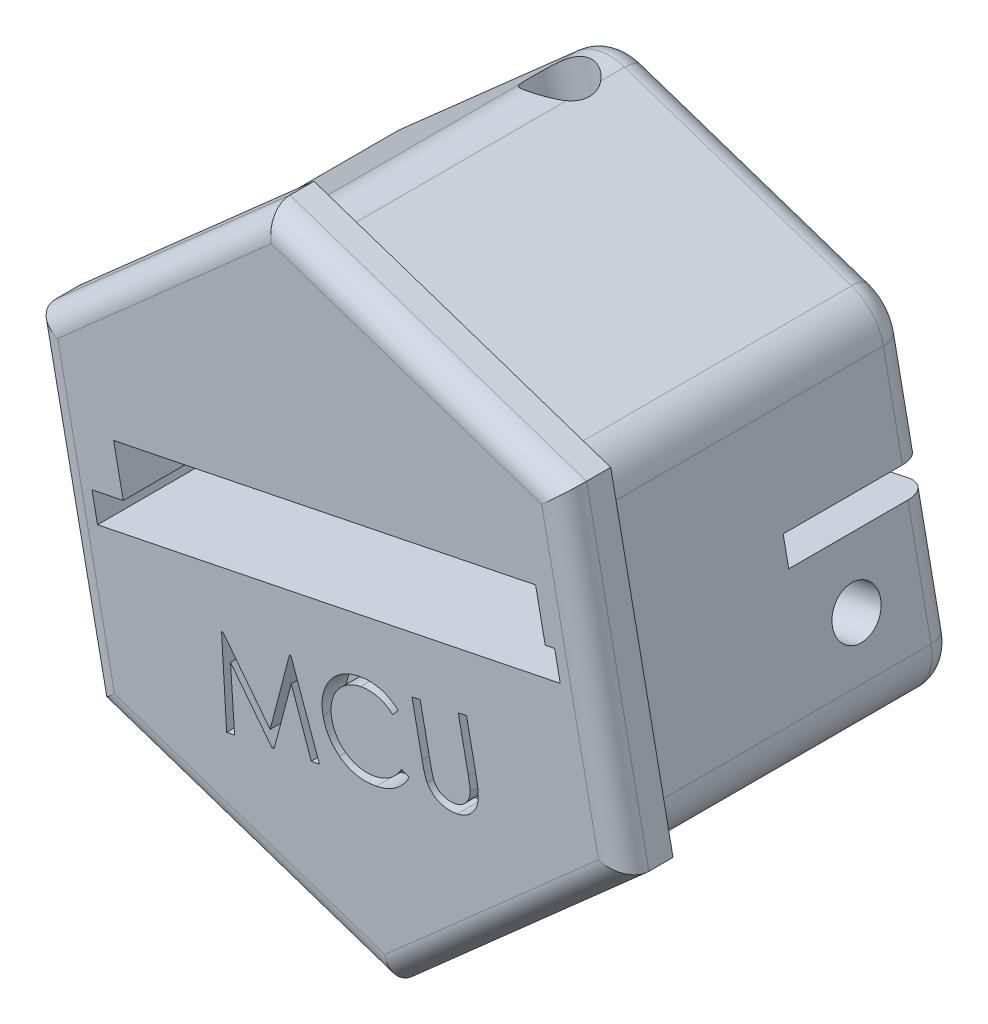
from build123d import *

# Parameters (mm, degrees)
DODANIE_WYCI_GNI_CIE1_DEPTH     = 14.65
ZAOKR_GLENIE1_R                 = 2
DODANIE_WYCI_GNI_CIE2_DEPTH     = 2
ZAOKR_GLENIE2_R                 = 1
ZAOKR_GLENIE3_R                 = 1
WYTNIJ_WYCI_GNI_CIE1_DEPTH      = 31.146962562
WYTNIJ_WYCI_GNI_CIE1_DEPTH_BACK = 31.146962562
SZKIC4_R                        = 1.225
GNIAZDO1_DEPTH                  = 14.65
GNIAZDO1_START                  = 1.35
GNIAZDO1_2_DEPTH                = 4.6
WYTNIJ_WYCI_GNI_CIE2_DEPTH      = 30.742315121
WYTNIJ_WYCI_GNI_CIE8_DEPTH      = 30.742315121
WYTNIJ_WYCI_GNI_CIE9_DEPTH      = 28.30701025
WYTNIJ_WYCI_GNI_CIE10_DEPTH     = 0.163959166
SZKIC10_R                       = 1.000244947
WYTNIJ_WYCI_GNI_CIE11_DEPTH     = 31.433256246
WYTNIJ_WYCI_GNI_CIE12_DEPTH     = 1


# Read off the part's stored shape, not the designer's step: Gniazdo1
with BuildPart() as part:
    # Szkic1 → Dodanie-wyciągnięcie1 (new body)
    with BuildSketch(Plane.XY):
        Polygon((1.783068787, -4.564092652), (-0.653727134, 7.430712848), (-12.25993137, 11.317788426), (-21.429339686, 3.210058505), (-18.992543765, -8.784746995), (-7.386339528, -12.671822573), align=None)
    extrude(amount=DODANIE_WYCI_GNI_CIE1_DEPTH)

    # Zaokrąglenie1
    zaokr_glenie1_edges = [part.edges().sort_by_distance(p)[0] for p in [
        (-7.386339528, -12.671822573, 7.325),
        (-18.992543765, -8.784746995, 7.325),
        (-21.429339686, 3.210058505, 7.325),
        (-12.25993137, 11.317788426, 7.325),
        (-0.653727134, 7.430712848, 7.325),
        (1.783068787, -4.564092652, 7.325),
    ]]
    fillet(zaokr_glenie1_edges, radius=ZAOKR_GLENIE1_R)

    # Szkic3 → Dodanie-wyciągnięcie2 (add)
    with BuildSketch(Plane.XY.offset(14.65)):
        Polygon((-0.091452095, 7.927884965), (-12.409357535, 12.053318952), (-22.141040889, 3.448416913), (-19.554818803, -9.281919113), (-7.236913363, -13.407353099), (2.494769991, -4.80245106), align=None)
    extrude(amount=-DODANIE_WYCI_GNI_CIE2_DEPTH)

    # Zaokrąglenie2
    zaokr_glenie2_edges = [part.edges().sort_by_distance(p)[0] for p in [
        (-6.456829252, 9.374250637, 0),
        (-2.80163537, -8.617957613, 0),
        (-13.189441647, -10.728284784, 0),
        (-20.210941725, -2.787344245, 0),
        (-16.844635528, 7.263923465, 0),
        (0.564670827, 1.433310098, 0),
        (-12.198333493, 11.014581025, 0),
        (-21.135955436, 3.111800131, 0),
        (-18.760757392, -8.579797968, 0),
        (-7.447937406, -12.368615173, 0),
        (1.489684537, -4.465834278, 0),
        (-0.885513507, 7.225763821, 0),
    ]]
    fillet(zaokr_glenie2_edges, radius=ZAOKR_GLENIE2_R)

    # Zaokrąglenie3
    zaokr_glenie3_edges = [part.edges().sort_by_distance(p)[0] for p in [
        (1.201658948, 1.562716953, 14.65),
        (-6.250404815, 9.990601959, 14.65),
        (-17.275199212, 7.750867932, 14.65),
        (-20.847929846, -2.9167511, 14.65),
        (-13.395866083, -11.344636106, 14.65),
        (-2.371071686, -9.10490208, 14.65),
    ]]
    fillet(zaokr_glenie3_edges, radius=ZAOKR_GLENIE3_R)

    # Szkic4 → Wytnij-wyciągnięcie1 (cut, two sides: drawn at the far end of the back side and taken through both)
    with BuildSketch(Plane(origin=(-0.257260592, 1.266331223, 0), x_dir=(0.9799817241599056, 0.19908746899937949, 0), z_dir=(-0.19908746899937946, 0.9799817241599055, 0)).offset(-WYTNIJ_WYCI_GNI_CIE1_DEPTH_BACK)):
        with Locations(Location((-9.76127883, -2.7, 0), (0, 0, 215.281261827))):
            Circle(SZKIC4_R)
    extrude(amount=WYTNIJ_WYCI_GNI_CIE1_DEPTH + WYTNIJ_WYCI_GNI_CIE1_DEPTH_BACK, mode=Mode.SUBTRACT)

    # Gniazdo1 outline → Gniazdo1 (cut)
    with BuildSketch(Plane.XY):
        Polygon((-0.219314552, 1.274040123), (-0.418402021, 2.254021847), (-19.626043815, -1.648092546), (-19.426956346, -2.62807427), align=None)
    extrude(amount=GNIAZDO1_DEPTH, mode=Mode.SUBTRACT)

    # Gniazdo1 2 outline → Gniazdo1 2 (cut)
    with BuildSketch(Plane.XY.offset(GNIAZDO1_START)):
        Polygon((0.564670827, 1.433310098), (0.365583358, 2.413291822), (-0.418402021, 2.254021847), (-0.219314552, 1.274040123), align=None)
        Polygon((-19.426956346, -2.62807427), (-19.626043815, -1.648092546), (-20.410029194, -1.807362521), (-20.210941725, -2.787344245), align=None)
    extrude(amount=GNIAZDO1_2_DEPTH, mode=Mode.SUBTRACT)

    # Szkic6 → Wytnij-wyciągnięcie2 (cut, through all)
    with BuildSketch(Plane.XY.offset(14.65)):
        Polygon((-0.219314552, 1.274040123), (-0.192027252, 1.112275263), (-19.394314131, -2.788751256), (-19.426956346, -2.62807427), align=None)
    extrude(amount=-WYTNIJ_WYCI_GNI_CIE2_DEPTH, mode=Mode.SUBTRACT)

    # Szkic7 → Wytnij-wyciągnięcie8 (cut, through all)
    with BuildSketch(Plane.XY.offset(14.65)):
        Polygon((-18.725742969, 0.575661799), (-1.209956317, 4.141509915), (-0.7540154, 1.897201078), (-18.269802052, -1.668647037), align=None)
    extrude(amount=-WYTNIJ_WYCI_GNI_CIE8_DEPTH, mode=Mode.SUBTRACT)

    # Szkic8 → Wytnij-wyciągnięcie9 (cut, through all)
    with BuildSketch(Plane(origin=(0, 0, 5.95), x_dir=(-1, 0, 0), z_dir=(0, 0, -1))):
        Polygon((20.410029194, -1.807362521), (22.58129373, -1.97298962), (22.243381446, -3.656769832), (20.210941725, -2.787344245), (19.426956346, -2.62807427), (0.219314552, 1.274040123), (-0.564670827, 1.433310098), (-0.365583358, 2.413291822), (0.418402021, 2.254021847), align=None)
    extrude(amount=WYTNIJ_WYCI_GNI_CIE9_DEPTH, mode=Mode.SUBTRACT)

    # Szkic9 → Wytnij-wyciągnięcie10 (cut)
    with BuildSketch(Plane(origin=(-0.257260592, 1.266331223, 0), x_dir=(0.9799817241599056, 0.19908746899937946, 0), z_dir=(-0.19908746899937943, 0.9799817241599055, 0))):
        Polygon((-20.36127883, -5.95), (0.83872117, -5.95), (6.124332065, 1.817495391), (-11.25710048, 4.560709404), (-28.076377149, 1.817495391), align=None)
    extrude(amount=-WYTNIJ_WYCI_GNI_CIE10_DEPTH, mode=Mode.SUBTRACT)

    # Szkic10 → Wytnij-wyciągnięcie11 (cut, through all)
    with BuildSketch(Plane(origin=(0.821931418, 0.166978875, 0), x_dir=(0, 0, -1), z_dir=(0.9799817241599057, 0.19908746899937887, 0))):
        with Locations(Location((-3.64, -1.402615616, 0), (0, 0, 90))):
            Circle(SZKIC10_R)
    extrude(amount=-WYTNIJ_WYCI_GNI_CIE11_DEPTH, mode=Mode.SUBTRACT)

    # Szkic11 → Wytnij-wyciągnięcie12 (cut)
    with BuildSketch(Plane.XY.offset(14.65)):
        Polygon((-14.035451173, -7.571751691), (-14.245787712, -4.056327011), (-14.189697968, -4.044407941), (-12.230062552, -6.564940793), (-11.425875853, -3.482108261), (-11.370487231, -3.470890312), (-10.184890276, -6.787897524), (-10.521428738, -6.85660746), (-11.352959186, -4.481206819), (-12.063896686, -7.170008902), (-12.149433545, -7.187536947), (-13.874193161, -4.974796562), (-13.70592393, -7.504443998), align=None)
        with BuildLine():
            Line((-6.910536367, -3.225905594), (-7.13840095, -3.486722902))
            add(Edge.make_bspline(
                [(-7.13840095, -3.486722902), (-7.162000049, -3.466791083), (-7.208604172, -3.427429202), (-7.282370026, -3.373901885), (-7.357751438, -3.325027822), (-7.434814258, -3.280675207), (-7.513948305, -3.241713857), (-7.595265283, -3.208583595), (-7.678006999, -3.178490713), (-7.791255569, -3.147223263), (-7.936331683, -3.119164226), (-8.114894071, -3.107014335), (-8.297557987, -3.113997799), (-8.418820489, -3.135213195), (-8.480348065, -3.14597771)],
                knots=[0, 0, 0, 0, 0.773865221, 1.528249413, 2.281996801, 3.02439624, 3.755154224, 4.490381002, 5.223926405, 5.960015728, 7.43254381, 8.918000902, 10.436219505, 12, 12, 12, 12], degree=3))
            add(Edge.make_bspline(
                [(-8.480348065, -3.14597771), (-8.514092395, -3.153558439), (-8.580888013, -3.168564204), (-8.678719455, -3.197289141), (-8.773143474, -3.23244922), (-8.864078492, -3.274251042), (-8.95291266, -3.320063637), (-9.037766601, -3.373219626), (-9.119928495, -3.431231947), (-9.198276104, -3.495068878), (-9.272141371, -3.563129066), (-9.340191046, -3.635274533), (-9.404060928, -3.70931203), (-9.460450375, -3.788167294), (-9.51178169, -3.869603851), (-9.557831497, -3.953883391), (-9.596791508, -4.042117962), (-9.631259617, -4.132772786), (-9.65939673, -4.225962438), (-9.680317872, -4.320939439), (-9.69498923, -4.416967118), (-9.70371181, -4.514384146), (-9.704792485, -4.613254742), (-9.699871601, -4.713456563), (-9.688754143, -4.815112066), (-9.676411666, -4.882721099), (-9.670151751, -4.917011364)],
                knots=[0, 0, 0, 0, 1.045856326, 2.070232893, 3.081206146, 4.090324377, 5.095747147, 6.102014371, 7.115997874, 8.136048703, 9.156466831, 10.151424097, 11.134331547, 12.111350141, 13.080151876, 14.044818935, 15.013001594, 15.995019063, 16.97673121, 17.954261064, 18.933960799, 19.913099379, 20.909862832, 21.921873411, 22.946006073, 24, 24, 24, 24], degree=3))
            add(Edge.make_bspline(
                [(-9.670151751, -4.917011364), (-9.658486887, -4.967754142), (-9.635554787, -5.067509989), (-9.585244385, -5.210589215), (-9.522720793, -5.34445163), (-9.447981509, -5.46902002), (-9.362058493, -5.585008094), (-9.263494879, -5.691509556), (-9.151620431, -5.787314356), (-9.030737563, -5.874961048), (-8.900726275, -5.949245068), (-8.765556476, -6.011117995), (-8.625296182, -6.0572181), (-8.480951024, -6.089833073), (-8.332197759, -6.107356973), (-8.179403255, -6.109590347), (-8.022047392, -6.098966446), (-7.916976288, -6.080023084), (-7.863360886, -6.070356716)],
                knots=[0, 0, 0, 0, 1.042026144, 2.048531902, 3.0304841, 3.996060659, 4.952692017, 5.91640663, 6.895141429, 7.897842476, 8.902115122, 9.888651748, 10.86988988, 11.853179555, 12.847599975, 13.863366506, 14.909724371, 16, 16, 16, 16], degree=3))
            add(Edge.make_bspline(
                [(-7.863360886, -6.070356716), (-7.805067676, -6.056588834), (-7.69024748, -6.029470222), (-7.525814641, -5.968754424), (-7.372953877, -5.890817801), (-7.229973532, -5.798437657), (-7.09988394, -5.687376515), (-6.979330617, -5.562198034), (-6.869624298, -5.420596614), (-6.808011801, -5.316433484), (-6.776622104, -5.26336553)],
                knots=[0, 0, 0, 0, 1.02688656, 2.022659534, 2.998078176, 3.965545903, 4.935776112, 5.925395782, 6.943052103, 8, 8, 8, 8], degree=3))
            Line((-6.776622104, -5.26336553), (-6.466025149, -5.413405594))
            add(Edge.make_bspline(
                [(-6.466025149, -5.413405594), (-6.482205231, -5.444488872), (-6.514382501, -5.506304076), (-6.569784901, -5.594519713), (-6.628520825, -5.679979842), (-6.693058346, -5.761155252), (-6.762815987, -5.838432819), (-6.837010745, -5.912213223), (-6.916683794, -5.981614793), (-7.000413016, -6.047561222), (-7.089194326, -6.108465167), (-7.181352692, -6.165376198), (-7.277950959, -6.216631974), (-7.378364058, -6.262982894), (-7.482829324, -6.304208266), (-7.59115435, -6.34075493), (-7.703235521, -6.372441369), (-7.779834453, -6.389282128), (-7.818489091, -6.397780594)],
                knots=[0, 0, 0, 0, 0.969989524, 1.929014682, 2.882279746, 3.840431077, 4.798167061, 5.763742404, 6.73599612, 7.722490275, 8.713411089, 9.715678695, 10.720304507, 11.739560909, 12.776679103, 13.828593113, 14.904228238, 16, 16, 16, 16], degree=3))
            add(Edge.make_bspline(
                [(-7.818489091, -6.397780594), (-7.855349409, -6.404953348), (-7.928328375, -6.419154533), (-8.037471638, -6.433292724), (-8.144550448, -6.44366491), (-8.249642112, -6.447552682), (-8.352836851, -6.447175106), (-8.453972905, -6.440877548), (-8.552940895, -6.428835454), (-8.65003748, -6.411907833), (-8.74543915, -6.39045517), (-8.838530306, -6.362978381), (-8.929640893, -6.330580192), (-9.018673036, -6.292780341), (-9.10561967, -6.249166787), (-9.190596567, -6.200407251), (-9.274342556, -6.14775486), (-9.327335853, -6.10789828), (-9.353945822, -6.087884761)],
                knots=[0, 0, 0, 0, 1.113245238, 2.204090815, 3.26192324, 4.302268114, 5.321015009, 6.320895248, 7.305114518, 8.275822087, 9.242489, 10.203000562, 11.152119423, 12.108497039, 13.069258572, 14.034558257, 15.013076257, 16, 16, 16, 16], degree=3))
            add(Edge.make_bspline(
                [(-9.353945822, -6.087884761), (-9.397450942, -6.052481912), (-9.483673032, -5.982317581), (-9.599357929, -5.863191458), (-9.704062437, -5.736119092), (-9.795201816, -5.598560788), (-9.874748306, -5.452162942), (-9.9420839, -5.29664927), (-9.997591874, -5.131840443), (-10.023144615, -5.017312364), (-10.036137328, -4.959078671)],
                knots=[0, 0, 0, 0, 0.997726045, 1.977377035, 2.950077668, 3.925088758, 4.909885176, 5.912310011, 6.938479565, 8, 8, 8, 8], degree=3))
            add(Edge.make_bspline(
                [(-10.036137328, -4.959078671), (-10.046940056, -4.897534863), (-10.068235336, -4.776214331), (-10.078695099, -4.593902089), (-10.073373598, -4.415523557), (-10.047166842, -4.241609829), (-10.005660264, -4.07135126), (-9.943732552, -3.905995328), (-9.864543662, -3.744638389), (-9.769183583, -3.588478181), (-9.658560812, -3.441752546), (-9.535478403, -3.307367005), (-9.399691166, -3.188620551), (-9.25350276, -3.082561863), (-9.094905022, -2.991993429), (-8.924738668, -2.916232447), (-8.743390095, -2.853876919), (-8.616910697, -2.824888425), (-8.55256361, -2.81014037)],
                knots=[0, 0, 0, 0, 1.027812541, 2.026113869, 3.000048712, 3.960325027, 4.91578054, 5.879817848, 6.860529486, 7.870680153, 8.887089618, 9.880844004, 10.864870138, 11.851442347, 12.849217233, 13.865211615, 14.913914719, 16, 16, 16, 16], degree=3))
            add(Edge.make_bspline(
                [(-8.55256361, -2.81014037), (-8.5131345, -2.802729481), (-8.435040521, -2.788051345), (-8.317779757, -2.773224793), (-8.202114926, -2.765948804), (-8.08838754, -2.763298525), (-7.976192561, -2.768228413), (-7.865801197, -2.780530078), (-7.756777162, -2.79755999), (-7.650061168, -2.822343383), (-7.546088049, -2.853350395), (-7.444586118, -2.888669083), (-7.347309663, -2.931218401), (-7.252662445, -2.978129533), (-7.161737796, -3.031264917), (-7.074511815, -3.090756302), (-6.990043902, -3.154884579), (-6.937107984, -3.202170193), (-6.910536367, -3.225905594)],
                knots=[0, 0, 0, 0, 1.093391556, 2.165590218, 3.219003715, 4.251150449, 5.264990791, 6.277288988, 7.277428155, 8.27103392, 9.260711242, 10.233849366, 11.19827502, 12.152634031, 13.111891518, 14.06597411, 15.02919985, 16, 16, 16, 16], degree=3))
        make_face()
        with BuildLine():
            Line((-6.34034411, -2.450282159), (-5.999598918, -2.380871101))
            Line((-5.999598918, -2.380871101), (-5.579626962, -4.443571422))
            add(Edge.make_bspline(
                [(-5.579626962, -4.443571422), (-5.573585635, -4.472792126), (-5.562124397, -4.528227868), (-5.545327335, -4.606762407), (-5.529830953, -4.676392316), (-5.515895785, -4.737414343), (-5.503177143, -4.789972856), (-5.492463969, -4.834121988), (-5.481811206, -4.869027308), (-5.475184705, -4.889259585), (-5.472355328, -4.897898345)],
                knots=[0, 0, 0, 0, 1.533336985, 2.908953575, 4.126912482, 5.199005335, 6.125307058, 6.905934553, 7.532856886, 8, 8, 8, 8], degree=3))
            add(Edge.make_bspline(
                [(-5.472355328, -4.897898345), (-5.460625061, -4.929262399), (-5.437900971, -4.990021423), (-5.394027559, -5.073938322), (-5.344181436, -5.148428345), (-5.286860649, -5.213650892), (-5.219058055, -5.268877405), (-5.14052408, -5.314834121), (-5.051072736, -5.353570363), (-4.952558118, -5.383695845), (-4.849324966, -5.403485114), (-4.745985192, -5.413057496), (-4.644676185, -5.41073985), (-4.578805081, -5.399741171), (-4.546173437, -5.394292576)],
                knots=[0, 0, 0, 0, 1.04218425, 2.018938533, 2.941600551, 3.828419522, 4.712935102, 5.652978114, 6.653740912, 7.74283979, 8.854951697, 9.921932094, 10.970553553, 12, 12, 12, 12], degree=3))
            add(Edge.make_bspline(
                [(-4.546173437, -5.394292576), (-4.518422182, -5.387639687), (-4.462956985, -5.374342855), (-4.383041817, -5.343815807), (-4.306487275, -5.305055343), (-4.234849936, -5.257350441), (-4.168162074, -5.203066198), (-4.109215254, -5.141988369), (-4.058312171, -5.075195125), (-4.014397396, -5.003600543), (-3.979399662, -4.926024746), (-3.952654365, -4.843271251), (-3.934178566, -4.755342827), (-3.929014184, -4.694656825), (-3.92638177, -4.663723665)],
                knots=[0, 0, 0, 0, 0.993013028, 1.984690912, 2.971144467, 3.975698375, 4.976155284, 5.960457503, 6.924185628, 7.895718456, 8.879179031, 9.880430216, 10.919602728, 12, 12, 12, 12], degree=3))
            add(Edge.make_bspline(
                [(-3.92638177, -4.663723665), (-3.925981973, -4.650868978), (-3.925094742, -4.622341846), (-3.927666465, -4.575533288), (-3.932714976, -4.520366087), (-3.940507621, -4.457014237), (-3.951005794, -4.384968843), (-3.965426675, -4.304942914), (-3.981316195, -4.216278272), (-3.993581057, -4.154688877), (-3.999999559, -4.12245764)],
                knots=[0, 0, 0, 0, 0.563781028, 1.251143347, 2.053767967, 2.993204259, 4.049832463, 5.246143888, 6.558839739, 8, 8, 8, 8], degree=3))
            Line((-3.999999559, -4.12245764), (-4.419971514, -2.059757319))
            Line((-4.419971514, -2.059757319), (-4.0785252, -1.98964514))
            Line((-4.0785252, -1.98964514), (-3.658553244, -4.05234546))
            add(Edge.make_bspline(
                [(-3.658553244, -4.05234546), (-3.651360437, -4.089706223), (-3.637361266, -4.162420492), (-3.619874201, -4.269494919), (-3.605360001, -4.371327685), (-3.596509544, -4.468698887), (-3.590809137, -4.561052277), (-3.588394019, -4.648531694), (-3.590490412, -4.73114059), (-3.596518375, -4.809395021), (-3.607913092, -4.884854351), (-3.624501621, -4.958605219), (-3.647965098, -5.030907107), (-3.676815316, -5.102238487), (-3.711903482, -5.172380172), (-3.753637382, -5.241362764), (-3.801368185, -5.309150386), (-3.854278997, -5.37559591), (-3.912527955, -5.438598857), (-3.977079182, -5.495515867), (-4.045514815, -5.547443311), (-4.118981548, -5.593637835), (-4.198082163, -5.632452631), (-4.281256504, -5.667022118), (-4.369693342, -5.695367309), (-4.43083489, -5.709099288), (-4.462038821, -5.71610748)],
                knots=[0, 0, 0, 0, 1.302651988, 2.535317338, 3.714538831, 4.823721464, 5.881940433, 6.882494412, 7.819051059, 8.71020213, 9.568036176, 10.429928838, 11.295417291, 12.167685901, 13.062350959, 13.977711808, 14.925651553, 15.899185274, 16.884324854, 17.859206027, 18.841872503, 19.823267468, 20.825292334, 21.85511361, 22.905345218, 24, 24, 24, 24], degree=3))
            add(Edge.make_bspline(
                [(-4.462038821, -5.71610748), (-4.496088036, -5.722440277), (-4.562960143, -5.734877789), (-4.662813577, -5.744856436), (-4.759999938, -5.749875093), (-4.854879783, -5.745746389), (-4.947827026, -5.736594653), (-5.038166906, -5.71856326), (-5.1262223, -5.695011172), (-5.211031061, -5.664020833), (-5.291810693, -5.627047492), (-5.368104083, -5.585112064), (-5.438356281, -5.53696479), (-5.504062366, -5.484303262), (-5.56434187, -5.426064511), (-5.619188859, -5.36269321), (-5.66889212, -5.294275951), (-5.697145853, -5.245226026), (-5.71143786, -5.220414371)],
                knots=[0, 0, 0, 0, 1.15118704, 2.260912744, 3.334424657, 4.384327513, 5.415949607, 6.437156062, 7.443917567, 8.44454096, 9.435703127, 10.395881372, 11.335714549, 12.26423298, 13.193109116, 14.118695685, 15.048351788, 16, 16, 16, 16], degree=3))
            add(Edge.make_bspline(
                [(-5.71143786, -5.220414371), (-5.720339608, -5.20323948), (-5.739611777, -5.166056064), (-5.764974933, -5.103242938), (-5.790854792, -5.03024175), (-5.816529023, -4.946893432), (-5.842366089, -4.853057102), (-5.869116538, -4.749168553), (-5.894682923, -4.634431564), (-5.911569446, -4.554598394), (-5.920372155, -4.51298248)],
                knots=[0, 0, 0, 0, 0.627310127, 1.358118356, 2.195085364, 3.139975468, 4.186704412, 5.35261496, 6.619955213, 8, 8, 8, 8], degree=3))
            Line((-5.920372155, -4.51298248), (-6.34034411, -2.450282159))
        make_face()
    extrude(amount=-WYTNIJ_WYCI_GNI_CIE12_DEPTH, mode=Mode.SUBTRACT)


solid = part.part
